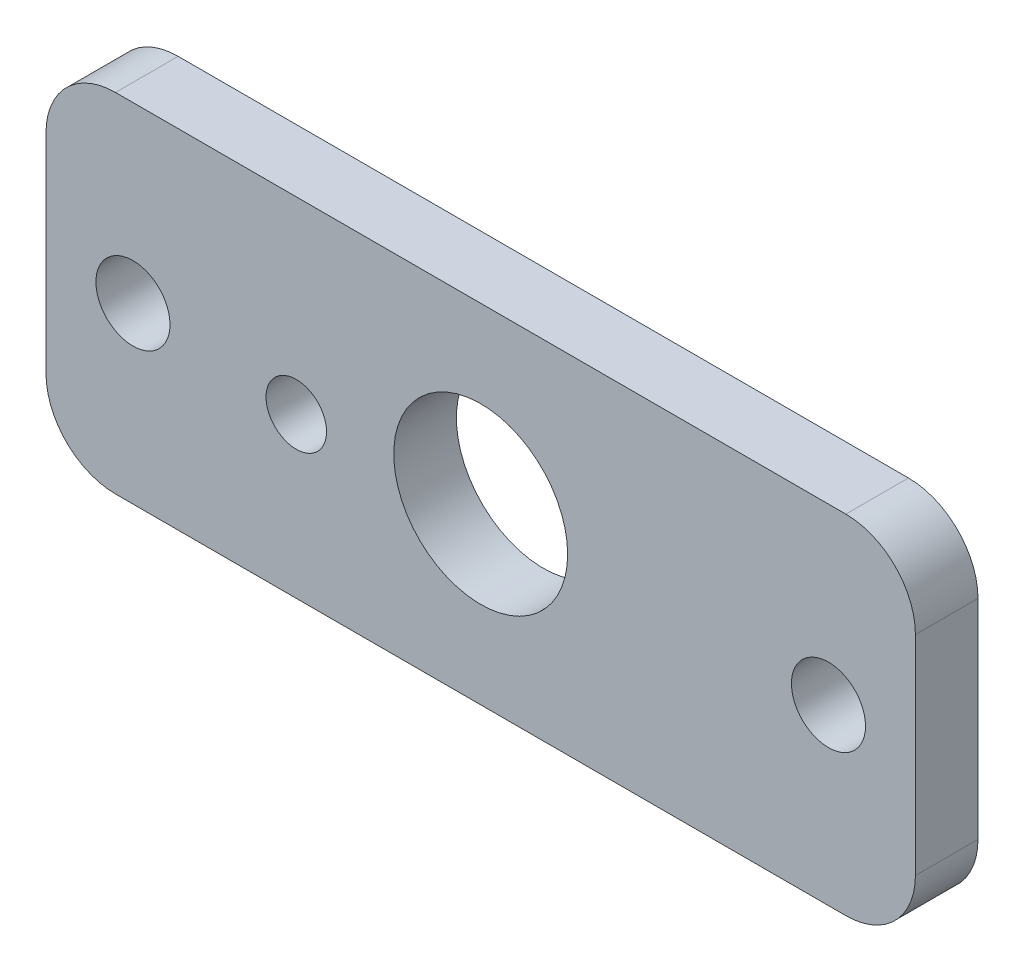
from build123d import *

# Parameters (mm, degrees)
SKETCH1_W             = 31.75
SKETCH1_H             = 12.7
BOSS_EXTRUDE1_DEPTH   = 2.286
FILLET1_R             = 2.54
SKETCH2_R             = 3.175
SKETCH2_R_2           = 1.1049
CUT_EXTRUDE1_DEPTH    = 174.210169025
F_2_CLEARANCE_HOLE1_D = 2.7051


with BuildPart() as part:
    # Sketch1 → Boss-Extrude1 (new body)
    with BuildSketch(Plane.XY):
        with Locations((-1.87e-07, -166.116000205)):
            Rectangle(SKETCH1_W, SKETCH1_H)
    extrude(amount=BOSS_EXTRUDE1_DEPTH)

    # Fillet1
    fillet1_edges = [part.edges().sort_by_distance(p)[0] for p in [
        (15.874999813, -172.466000205, 1.143),
        (-15.875000187, -172.466000205, 1.143),
        (15.874999813, -159.766000205, 1.143),
        (-15.875000187, -159.766000205, 1.143),
    ]]
    fillet(fillet1_edges, radius=FILLET1_R)

    # Sketch2 → Cut-Extrude1 (cut, through all)
    with BuildSketch(Plane.XY.offset(2.286)):
        with Locations((-1.87e-07, -166.116000205)):
            Circle(SKETCH2_R)
        with Locations((-6.735572471, -166.64610111)):
            Circle(SKETCH2_R_2)
    extrude(amount=-CUT_EXTRUDE1_DEPTH, mode=Mode.SUBTRACT)

    # #2 Clearance Hole1 (through all)
    with Locations(Plane.XY.offset(2.286)):
        with Locations((12.699999906, -166.116000205), (-12.700000094, -166.116000205)):
            Hole(F_2_CLEARANCE_HOLE1_D / 2)


solid = part.part
